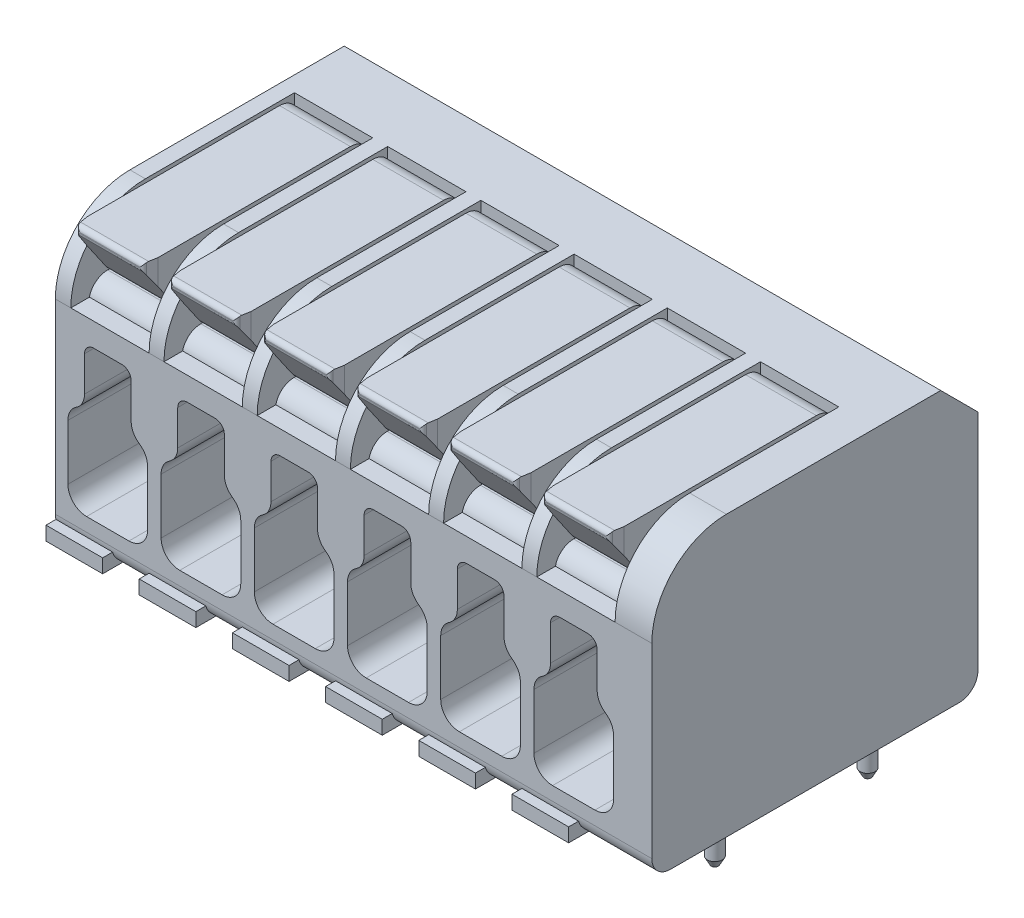
from build123d import *
from OCP.BRepFilletAPI import BRepFilletAPI_MakeChamfer

# Parameters (mm, degrees)
BOSS_EXTRUDE1_DEPTH = 32
CUT_EXTRUDE1_DEPTH  = 10
SKETCH2_3_W         = 4.2
SKETCH2_3_H         = 3.22340893
CUT_EXTRUDE2_DEPTH  = 12
SKETCH2_4_W         = 4.2
SKETCH2_4_H         = 0.77659107
CUT_EXTRUDE3_DEPTH  = 1
FILLET3_R           = 1
BOSS_EXTRUDE2_START = -18
SKETCH2_5_W         = 3.039090902
SKETCH2_5_H         = 0.743740294
BOSS_EXTRUDE2_DEPTH = 18.5
BOSS_EXTRUDE3_START = 0.2
BOSS_EXTRUDE3_DEPTH = 3.8
CUT_EXTRUDE4_DEPTH  = 5
SKETCH4_R           = 0.4
BOSS_EXTRUDE4_DEPTH = 5
CHAMFER1_SIZE       = 0.4
CHAMFER1_SIZE2      = 0.212683773
LPATTERN1_START     = 5
LPATTERN1_DEPTH     = 3.039090902
LPATTERN1_START_2   = 10
LPATTERN1_2_DEPTH   = 3.039090902
LPATTERN1_START_3   = 15
LPATTERN1_3_DEPTH   = 3.039090902
LPATTERN1_START_4   = 20
LPATTERN1_4_DEPTH   = 3.039090902
LPATTERN1_START_5   = 25
LPATTERN1_5_DEPTH   = 3.039090902
LPATTERN1_START_6   = 5.83
LPATTERN1_16_DEPTH  = 4.2
LPATTERN1_START_7   = 10.83
LPATTERN1_17_DEPTH  = 4.2
LPATTERN1_START_8   = 15.83
LPATTERN1_18_DEPTH  = 4.2
LPATTERN1_START_9   = 20.83
LPATTERN1_19_DEPTH  = 4.2
LPATTERN1_START_10  = 25.83
LPATTERN1_20_DEPTH  = 4.2
LPATTERN1_START_11  = -10
LPATTERN1_21_DEPTH  = 10
LPATTERN2_COUNT     = 6
LPATTERN2_PITCH     = 5


# Read off the part's stored shape, not the designer's step: LPattern1
with BuildPart() as part:
    # Sketch1 → Boss-Extrude1 (new body)
    with BuildSketch(Plane(origin=(0, 0, 0), x_dir=(0, 0, -1), z_dir=(1, 0, 0))):
        with BuildLine():
            Line((15.5, 15), (17.5, 13))
            Line((17.5, 13), (17.5, 1))
            ThreePointArc((17.5, 1), (17.207106781, 0.292893219), (16.5, 0))
            Line((16.5, 0), (1, 0))
            ThreePointArc((1, 0), (0.292893219, 0.292893219), (0, 1))
            Line((0, 1), (0, 11))
            ThreePointArc((0, 11), (1.171572875, 13.828427125), (4, 15))
            Line((4, 15), (15.5, 15))
        make_face()
    extrude(amount=BOSS_EXTRUDE1_DEPTH)

    # Sketch2 → Cut-Extrude1 (cut)
    with BuildSketch(Plane.XY):
        with BuildLine():
            Line((2.067688436, 9.742953882), (3.568332036, 9.742953882))
            ThreePointArc((3.568332036, 9.742953882), (3.921885427, 9.596507273), (4.068332036, 9.242953882))
            Line((4.068332036, 9.242953882), (4.068332036, 7.356120034))
            ThreePointArc((4.068332036, 7.356120034), (4.185188026, 6.887018065), (4.50844535, 6.527550846))
            ThreePointArc((4.50844535, 6.527550846), (4.831702674, 6.168083627), (4.948558664, 5.698981659))
            Line((4.948558664, 5.698981659), (4.948558664, 2.730887774))
            ThreePointArc((4.948558664, 2.730887774), (4.655665445, 2.023780993), (3.948558664, 1.730887774))
            Line((3.948558664, 1.730887774), (1.675767064, 1.730887774))
            ThreePointArc((1.675767064, 1.730887774), (0.968660283, 2.023780993), (0.675767064, 2.730887774))
            Line((0.675767064, 2.730887774), (0.675767064, 5.698981659))
            ThreePointArc((0.675767064, 5.698981659), (0.794279879, 6.171189603), (1.12172775, 6.531472162))
            ThreePointArc((1.12172775, 6.531472162), (1.449175621, 6.891754721), (1.567688436, 7.363962665))
            Line((1.567688436, 7.363962665), (1.567688436, 9.242953882))
            ThreePointArc((1.567688436, 9.242953882), (1.714135045, 9.596507273), (2.067688436, 9.742953882))
        make_face()
    extrude(amount=-CUT_EXTRUDE1_DEPTH, mode=Mode.SUBTRACT)

    # Sketch2<3> → Cut-Extrude2 (cut)
    with BuildSketch(Plane.XY):
        with Locations((2.93, 13.388295535)):
            Rectangle(SKETCH2_3_W, SKETCH2_3_H)
    extrude(amount=-CUT_EXTRUDE2_DEPTH, mode=Mode.SUBTRACT)

    # Sketch2<4> → Cut-Extrude3 (cut)
    with BuildSketch(Plane.XY):
        with Locations((2.93, 11.388295535)):
            Rectangle(SKETCH2_4_W, SKETCH2_4_H)
    extrude(amount=-CUT_EXTRUDE3_DEPTH, mode=Mode.SUBTRACT)

    # Fillet3
    # the kernel refuses this fillet: 1 mm, written as the material it takes off along each edge
    with BuildSketch(Plane(origin=(5.03, 11.77659107, -1), x_dir=(0, 0, -1), z_dir=(-1, 0, 0))) as fillet3_piece_1:
        with BuildLine():
            CenterArc((0.974724807, 1), FILLET3_R, 192.909335159, 77.090664841)
            Line((0, 0.77659107), (0, 0))
            Line((0, 0), (0.974724807, 0))
        make_face()
    extrude(amount=4.2, mode=Mode.SUBTRACT)

    # Sketch2<5> → Boss-Extrude2 (add)
    with BuildSketch(Plane.XY.offset(BOSS_EXTRUDE2_START)):
        with Locations((1.519545451, 0.371870147)):
            Rectangle(SKETCH2_5_W, SKETCH2_5_H)
    extrude(amount=BOSS_EXTRUDE2_DEPTH)

    # Sketch4 → Boss-Extrude4 (add)
    with BuildSketch(Plane.XZ):
        with Locations(Location((2.95, -7.43, 0), (0, 0, 90))):
            Circle(SKETCH4_R)
        with Locations(Location((2.95, -15.63, 0), (0, 0, 90))):
            Circle(SKETCH4_R)
    extrude(amount=BOSS_EXTRUDE4_DEPTH)

    # Chamfer1: one chamfer whose edges measure the first distance from different faces: ONE call of the kernel's chamfer builder (chamfer() names one face for all edges)
    chamfer1_edges_1 = [part.edges().sort_by_distance(p)[0] for p in [
        (2.95, -5, -7.83),
    ]]
    chamfer1_side_1 = [part.faces().sort_by_distance(p)[0] for p in [
        (2.95, -2.5, -7.83),
    ]]
    chamfer1_edges_2 = [part.edges().sort_by_distance(p)[0] for p in [
        (2.95, -5, -16.03),
    ]]
    chamfer1_side_2 = [part.faces().sort_by_distance(p)[0] for p in [
        (2.95, -2.5, -16.03),
    ]]
    chamfer1 = BRepFilletAPI_MakeChamfer(part.part.solid().wrapped)
    for e in chamfer1_edges_1:
        chamfer1.Add(CHAMFER1_SIZE, CHAMFER1_SIZE2, e.wrapped, chamfer1_side_1[0].wrapped)  # the first distance lies on this face
    for e in chamfer1_edges_2:
        chamfer1.Add(CHAMFER1_SIZE, CHAMFER1_SIZE2, e.wrapped, chamfer1_side_2[0].wrapped)  # the first distance lies on this face
    add(Compound.cast(chamfer1.Shape()), mode=Mode.REPLACE)

    # LPattern1 outline → LPattern1 (add)
    with BuildSketch(Plane.YZ.offset(LPATTERN1_START)):
        with BuildLine():
            ThreePointArc((0.743740294, -17.466607968), (0.207453564, -17.109811567), (0, -16.5))
            Line((0, -16.5), (0, -18))
            Line((0, -18), (0.743740294, -18))
            Line((0.743740294, -18), (0.743740294, -17.466607968))
        make_face()
        with BuildLine():
            ThreePointArc((0, -1), (0.207453564, -0.390188433), (0.743740294, -0.033392032))
            Line((0.743740294, -0.033392032), (0.743740294, 0.5))
            Line((0.743740294, 0.5), (0, 0.5))
            Line((0, 0.5), (0, -1))
        make_face()
    extrude(amount=LPATTERN1_DEPTH)

    # LPattern1 2 outline → LPattern1 2 (add)
    with BuildSketch(Plane.YZ.offset(LPATTERN1_START_2)):
        with BuildLine():
            ThreePointArc((0.743740294, -17.466607968), (0.207453564, -17.109811567), (0, -16.5))
            Line((0, -16.5), (0, -18))
            Line((0, -18), (0.743740294, -18))
            Line((0.743740294, -18), (0.743740294, -17.466607968))
        make_face()
        with BuildLine():
            ThreePointArc((0, -1), (0.207453564, -0.390188433), (0.743740294, -0.033392032))
            Line((0.743740294, -0.033392032), (0.743740294, 0.5))
            Line((0.743740294, 0.5), (0, 0.5))
            Line((0, 0.5), (0, -1))
        make_face()
    extrude(amount=LPATTERN1_2_DEPTH)

    # LPattern1 3 outline → LPattern1 3 (add)
    with BuildSketch(Plane.YZ.offset(LPATTERN1_START_3)):
        with BuildLine():
            ThreePointArc((0.743740294, -17.466607968), (0.207453564, -17.109811567), (0, -16.5))
            Line((0, -16.5), (0, -18))
            Line((0, -18), (0.743740294, -18))
            Line((0.743740294, -18), (0.743740294, -17.466607968))
        make_face()
        with BuildLine():
            ThreePointArc((0, -1), (0.207453564, -0.390188433), (0.743740294, -0.033392032))
            Line((0.743740294, -0.033392032), (0.743740294, 0.5))
            Line((0.743740294, 0.5), (0, 0.5))
            Line((0, 0.5), (0, -1))
        make_face()
    extrude(amount=LPATTERN1_3_DEPTH)

    # LPattern1 4 outline → LPattern1 4 (add)
    with BuildSketch(Plane.YZ.offset(LPATTERN1_START_4)):
        with BuildLine():
            ThreePointArc((0.743740294, -17.466607968), (0.207453564, -17.109811567), (0, -16.5))
            Line((0, -16.5), (0, -18))
            Line((0, -18), (0.743740294, -18))
            Line((0.743740294, -18), (0.743740294, -17.466607968))
        make_face()
        with BuildLine():
            ThreePointArc((0, -1), (0.207453564, -0.390188433), (0.743740294, -0.033392032))
            Line((0.743740294, -0.033392032), (0.743740294, 0.5))
            Line((0.743740294, 0.5), (0, 0.5))
            Line((0, 0.5), (0, -1))
        make_face()
    extrude(amount=LPATTERN1_4_DEPTH)

    # LPattern1 5 outline → LPattern1 5 (add)
    with BuildSketch(Plane.YZ.offset(LPATTERN1_START_5)):
        with BuildLine():
            ThreePointArc((0.743740294, -17.466607968), (0.207453564, -17.109811567), (0, -16.5))
            Line((0, -16.5), (0, -18))
            Line((0, -18), (0.743740294, -18))
            Line((0.743740294, -18), (0.743740294, -17.466607968))
        make_face()
        with BuildLine():
            ThreePointArc((0, -1), (0.207453564, -0.390188433), (0.743740294, -0.033392032))
            Line((0.743740294, -0.033392032), (0.743740294, 0.5))
            Line((0.743740294, 0.5), (0, 0.5))
            Line((0, 0.5), (0, -1))
        make_face()
    extrude(amount=LPATTERN1_5_DEPTH)

    # LPattern1 6 outline → LPattern1 6 (revolve)
    with BuildSketch(Plane(origin=(7.95, 0, -7.43), x_dir=(1, 0, 0), z_dir=(0, 0, 1))):
        Polygon((0, 0), (0, -5), (0.187316227, -5), (0.4, -4.6), (0.4, 0), align=None)
    revolve(axis=Axis((7.95, 0, -7.43), (0, 1, 0)))

    # LPattern1 7 outline → LPattern1 7 (revolve)
    with BuildSketch(Plane(origin=(27.95, 0, -15.63), x_dir=(1, 0, 0), z_dir=(0, 0, 1))):
        Polygon((0, 0), (0, -5), (0.187316227, -5), (0.4, -4.6), (0.4, 0), align=None)
    revolve(axis=Axis((27.95, 0, -15.63), (0, 1, 0)))

    # LPattern1 8 outline → LPattern1 8 (revolve)
    with BuildSketch(Plane(origin=(17.95, 0, -7.43), x_dir=(1, 0, 0), z_dir=(0, 0, 1))):
        Polygon((0, 0), (0, -5), (0.187316227, -5), (0.4, -4.6), (0.4, 0), align=None)
    revolve(axis=Axis((17.95, 0, -7.43), (0, 1, 0)))

    # LPattern1 9 outline → LPattern1 9 (revolve)
    with BuildSketch(Plane(origin=(12.95, 0, -15.63), x_dir=(1, 0, 0), z_dir=(0, 0, 1))):
        Polygon((0, 0), (0, -5), (0.187316227, -5), (0.4, -4.6), (0.4, 0), align=None)
    revolve(axis=Axis((12.95, 0, -15.63), (0, 1, 0)))

    # LPattern1 10 outline → LPattern1 10 (revolve)
    with BuildSketch(Plane(origin=(12.95, 0, -7.43), x_dir=(1, 0, 0), z_dir=(0, 0, 1))):
        Polygon((0, 0), (0, -5), (0.187316227, -5), (0.4, -4.6), (0.4, 0), align=None)
    revolve(axis=Axis((12.95, 0, -7.43), (0, 1, 0)))

    # LPattern1 11 outline → LPattern1 11 (revolve)
    with BuildSketch(Plane(origin=(7.95, 0, -15.63), x_dir=(1, 0, 0), z_dir=(0, 0, 1))):
        Polygon((0, 0), (0, -5), (0.187316227, -5), (0.4, -4.6), (0.4, 0), align=None)
    revolve(axis=Axis((7.95, 0, -15.63), (0, 1, 0)))

    # LPattern1 12 outline → LPattern1 12 (revolve)
    with BuildSketch(Plane(origin=(27.95, 0, -7.43), x_dir=(1, 0, 0), z_dir=(0, 0, 1))):
        Polygon((0, 0), (0, -5), (0.187316227, -5), (0.4, -4.6), (0.4, 0), align=None)
    revolve(axis=Axis((27.95, 0, -7.43), (0, 1, 0)))

    # LPattern1 13 outline → LPattern1 13 (revolve)
    with BuildSketch(Plane(origin=(22.95, 0, -15.63), x_dir=(1, 0, 0), z_dir=(0, 0, 1))):
        Polygon((0, 0), (0, -5), (0.187316227, -5), (0.4, -4.6), (0.4, 0), align=None)
    revolve(axis=Axis((22.95, 0, -15.63), (0, 1, 0)))

    # LPattern1 14 outline → LPattern1 14 (revolve)
    with BuildSketch(Plane(origin=(22.95, 0, -7.43), x_dir=(1, 0, 0), z_dir=(0, 0, 1))):
        Polygon((0, 0), (0, -5), (0.187316227, -5), (0.4, -4.6), (0.4, 0), align=None)
    revolve(axis=Axis((22.95, 0, -7.43), (0, 1, 0)))

    # LPattern1 15 outline → LPattern1 15 (revolve)
    with BuildSketch(Plane(origin=(17.95, 0, -15.63), x_dir=(1, 0, 0), z_dir=(0, 0, 1))):
        Polygon((0, 0), (0, -5), (0.187316227, -5), (0.4, -4.6), (0.4, 0), align=None)
    revolve(axis=Axis((17.95, 0, -15.63), (0, 1, 0)))

    # LPattern1 16 outline → LPattern1 16 (cut)
    with BuildSketch(Plane.YZ.offset(LPATTERN1_START_6)):
        with BuildLine():
            ThreePointArc((11, -1), (11.558706448, -1.351591166), (11.77659107, -1.974724807))
            Line((11.77659107, -1.974724807), (11.77659107, -12))
            Line((11.77659107, -12), (15, -12))
            Line((15, -12), (15, -4))
            ThreePointArc((15, -4), (13.828427125, -1.171572875), (11, 0))
            Line((11, 0), (11, -1))
        make_face()
    extrude(amount=LPATTERN1_16_DEPTH, mode=Mode.SUBTRACT)

    # LPattern1 17 outline → LPattern1 17 (cut)
    with BuildSketch(Plane.YZ.offset(LPATTERN1_START_7)):
        with BuildLine():
            ThreePointArc((11, -1), (11.558706448, -1.351591166), (11.77659107, -1.974724807))
            Line((11.77659107, -1.974724807), (11.77659107, -12))
            Line((11.77659107, -12), (15, -12))
            Line((15, -12), (15, -4))
            ThreePointArc((15, -4), (13.828427125, -1.171572875), (11, 0))
            Line((11, 0), (11, -1))
        make_face()
    extrude(amount=LPATTERN1_17_DEPTH, mode=Mode.SUBTRACT)

    # LPattern1 18 outline → LPattern1 18 (cut)
    with BuildSketch(Plane.YZ.offset(LPATTERN1_START_8)):
        with BuildLine():
            ThreePointArc((11, -1), (11.558706448, -1.351591166), (11.77659107, -1.974724807))
            Line((11.77659107, -1.974724807), (11.77659107, -12))
            Line((11.77659107, -12), (15, -12))
            Line((15, -12), (15, -4))
            ThreePointArc((15, -4), (13.828427125, -1.171572875), (11, 0))
            Line((11, 0), (11, -1))
        make_face()
    extrude(amount=LPATTERN1_18_DEPTH, mode=Mode.SUBTRACT)

    # LPattern1 19 outline → LPattern1 19 (cut)
    with BuildSketch(Plane.YZ.offset(LPATTERN1_START_9)):
        with BuildLine():
            ThreePointArc((11, -1), (11.558706448, -1.351591166), (11.77659107, -1.974724807))
            Line((11.77659107, -1.974724807), (11.77659107, -12))
            Line((11.77659107, -12), (15, -12))
            Line((15, -12), (15, -4))
            ThreePointArc((15, -4), (13.828427125, -1.171572875), (11, 0))
            Line((11, 0), (11, -1))
        make_face()
    extrude(amount=LPATTERN1_19_DEPTH, mode=Mode.SUBTRACT)

    # LPattern1 20 outline → LPattern1 20 (cut)
    with BuildSketch(Plane.YZ.offset(LPATTERN1_START_10)):
        with BuildLine():
            ThreePointArc((11, -1), (11.558706448, -1.351591166), (11.77659107, -1.974724807))
            Line((11.77659107, -1.974724807), (11.77659107, -12))
            Line((11.77659107, -12), (15, -12))
            Line((15, -12), (15, -4))
            ThreePointArc((15, -4), (13.828427125, -1.171572875), (11, 0))
            Line((11, 0), (11, -1))
        make_face()
    extrude(amount=LPATTERN1_20_DEPTH, mode=Mode.SUBTRACT)

    # LPattern1 21 outline → LPattern1 21 (cut)
    with BuildSketch(Plane.XY.offset(LPATTERN1_START_11)):
        with BuildLine():
            Line((28.568332036, 9.742953882), (27.067688436, 9.742953882))
            ThreePointArc((27.067688436, 9.742953882), (26.714135045, 9.596507273), (26.567688436, 9.242953882))
            Line((26.567688436, 9.242953882), (26.567688436, 7.363962665))
            ThreePointArc((26.567688436, 7.363962665), (26.449175621, 6.891754721), (26.12172775, 6.531472162))
            ThreePointArc((26.12172775, 6.531472162), (25.794279879, 6.171189603), (25.675767064, 5.698981659))
            Line((25.675767064, 5.698981659), (25.675767064, 2.730887774))
            ThreePointArc((25.675767064, 2.730887774), (25.968660283, 2.023780993), (26.675767064, 1.730887774))
            Line((26.675767064, 1.730887774), (28.948558664, 1.730887774))
            ThreePointArc((28.948558664, 1.730887774), (29.655665445, 2.023780993), (29.948558664, 2.730887774))
            Line((29.948558664, 2.730887774), (29.948558664, 5.698981659))
            ThreePointArc((29.948558664, 5.698981659), (29.831702674, 6.168083627), (29.50844535, 6.527550846))
            ThreePointArc((29.50844535, 6.527550846), (29.185188026, 6.887018065), (29.068332036, 7.356120034))
            Line((29.068332036, 7.356120034), (29.068332036, 9.242953882))
            ThreePointArc((29.068332036, 9.242953882), (28.921885427, 9.596507273), (28.568332036, 9.742953882))
        make_face()
        with BuildLine():
            Line((23.568332036, 9.742953882), (22.067688436, 9.742953882))
            ThreePointArc((22.067688436, 9.742953882), (21.714135045, 9.596507273), (21.567688436, 9.242953882))
            Line((21.567688436, 9.242953882), (21.567688436, 7.363962665))
            ThreePointArc((21.567688436, 7.363962665), (21.449175621, 6.891754721), (21.12172775, 6.531472162))
            ThreePointArc((21.12172775, 6.531472162), (20.794279879, 6.171189603), (20.675767064, 5.698981659))
            Line((20.675767064, 5.698981659), (20.675767064, 2.730887774))
            ThreePointArc((20.675767064, 2.730887774), (20.968660283, 2.023780993), (21.675767064, 1.730887774))
            Line((21.675767064, 1.730887774), (23.948558664, 1.730887774))
            ThreePointArc((23.948558664, 1.730887774), (24.655665445, 2.023780993), (24.948558664, 2.730887774))
            Line((24.948558664, 2.730887774), (24.948558664, 5.698981659))
            ThreePointArc((24.948558664, 5.698981659), (24.831702674, 6.168083627), (24.50844535, 6.527550846))
            ThreePointArc((24.50844535, 6.527550846), (24.185188026, 6.887018065), (24.068332036, 7.356120034))
            Line((24.068332036, 7.356120034), (24.068332036, 9.242953882))
            ThreePointArc((24.068332036, 9.242953882), (23.921885427, 9.596507273), (23.568332036, 9.742953882))
        make_face()
        with BuildLine():
            Line((18.568332036, 9.742953882), (17.067688436, 9.742953882))
            ThreePointArc((17.067688436, 9.742953882), (16.714135045, 9.596507273), (16.567688436, 9.242953882))
            Line((16.567688436, 9.242953882), (16.567688436, 7.363962665))
            ThreePointArc((16.567688436, 7.363962665), (16.449175621, 6.891754721), (16.12172775, 6.531472162))
            ThreePointArc((16.12172775, 6.531472162), (15.794279879, 6.171189603), (15.675767064, 5.698981659))
            Line((15.675767064, 5.698981659), (15.675767064, 2.730887774))
            ThreePointArc((15.675767064, 2.730887774), (15.968660283, 2.023780993), (16.675767064, 1.730887774))
            Line((16.675767064, 1.730887774), (18.948558664, 1.730887774))
            ThreePointArc((18.948558664, 1.730887774), (19.655665445, 2.023780993), (19.948558664, 2.730887774))
            Line((19.948558664, 2.730887774), (19.948558664, 5.698981659))
            ThreePointArc((19.948558664, 5.698981659), (19.831702674, 6.168083627), (19.50844535, 6.527550846))
            ThreePointArc((19.50844535, 6.527550846), (19.185188026, 6.887018065), (19.068332036, 7.356120034))
            Line((19.068332036, 7.356120034), (19.068332036, 9.242953882))
            ThreePointArc((19.068332036, 9.242953882), (18.921885427, 9.596507273), (18.568332036, 9.742953882))
        make_face()
        with BuildLine():
            Line((13.568332036, 9.742953882), (12.067688436, 9.742953882))
            ThreePointArc((12.067688436, 9.742953882), (11.714135045, 9.596507273), (11.567688436, 9.242953882))
            Line((11.567688436, 9.242953882), (11.567688436, 7.363962665))
            ThreePointArc((11.567688436, 7.363962665), (11.449175621, 6.891754721), (11.12172775, 6.531472162))
            ThreePointArc((11.12172775, 6.531472162), (10.794279879, 6.171189603), (10.675767064, 5.698981659))
            Line((10.675767064, 5.698981659), (10.675767064, 2.730887774))
            ThreePointArc((10.675767064, 2.730887774), (10.968660283, 2.023780993), (11.675767064, 1.730887774))
            Line((11.675767064, 1.730887774), (13.948558664, 1.730887774))
            ThreePointArc((13.948558664, 1.730887774), (14.655665445, 2.023780993), (14.948558664, 2.730887774))
            Line((14.948558664, 2.730887774), (14.948558664, 5.698981659))
            ThreePointArc((14.948558664, 5.698981659), (14.831702674, 6.168083627), (14.50844535, 6.527550846))
            ThreePointArc((14.50844535, 6.527550846), (14.185188026, 6.887018065), (14.068332036, 7.356120034))
            Line((14.068332036, 7.356120034), (14.068332036, 9.242953882))
            ThreePointArc((14.068332036, 9.242953882), (13.921885427, 9.596507273), (13.568332036, 9.742953882))
        make_face()
        with BuildLine():
            Line((8.568332036, 9.742953882), (7.067688436, 9.742953882))
            ThreePointArc((7.067688436, 9.742953882), (6.714135045, 9.596507273), (6.567688436, 9.242953882))
            Line((6.567688436, 9.242953882), (6.567688436, 7.363962665))
            ThreePointArc((6.567688436, 7.363962665), (6.449175621, 6.891754721), (6.12172775, 6.531472162))
            ThreePointArc((6.12172775, 6.531472162), (5.794279879, 6.171189603), (5.675767064, 5.698981659))
            Line((5.675767064, 5.698981659), (5.675767064, 2.730887774))
            ThreePointArc((5.675767064, 2.730887774), (5.968660283, 2.023780993), (6.675767064, 1.730887774))
            Line((6.675767064, 1.730887774), (8.948558664, 1.730887774))
            ThreePointArc((8.948558664, 1.730887774), (9.655665445, 2.023780993), (9.948558664, 2.730887774))
            Line((9.948558664, 2.730887774), (9.948558664, 5.698981659))
            ThreePointArc((9.948558664, 5.698981659), (9.831702674, 6.168083627), (9.50844535, 6.527550846))
            ThreePointArc((9.50844535, 6.527550846), (9.185188026, 6.887018065), (9.068332036, 7.356120034))
            Line((9.068332036, 7.356120034), (9.068332036, 9.242953882))
            ThreePointArc((9.068332036, 9.242953882), (8.921885427, 9.596507273), (8.568332036, 9.742953882))
        make_face()
    extrude(amount=LPATTERN1_21_DEPTH, mode=Mode.SUBTRACT)


with BuildPart() as body_2:
    # Sketch3 → Boss-Extrude3 (new body)
    with BuildSketch(Plane.ZY.offset(-5.03).offset(BOSS_EXTRUDE3_START)):
        with BuildLine():
            Line((-12, 14), (-12, 11.77659107))
            Line((-12, 11.77659107), (-2.498455168, 11.77659107))
            ThreePointArc((-2.498455168, 11.77659107), (-2.034503203, 11.890730712), (-1.67646186, 12.207093921))
            Line((-1.67646186, 12.207093921), (-0.044501673, 14.562611162))
            ThreePointArc((-0.044501673, 14.562611162), (-0.011384638, 14.630401878), (0, 14.704985449))
            Line((0, 14.704985449), (0, 14.75))
            ThreePointArc((0, 14.75), (-0.073223305, 14.926776695), (-0.25, 15))
            Line((-0.25, 15), (-11, 15))
            ThreePointArc((-11, 15), (-11.707106781, 14.707106781), (-12, 14))
        make_face()
    extrude(amount=BOSS_EXTRUDE3_DEPTH)

    # Sketch5 → Cut-Extrude4 (cut)
    with BuildSketch(Plane(origin=(0, 15, 0), x_dir=(1, 0, 0), z_dir=(0, 1, 0))):
        with BuildLine():
            Line((4.83, 0.680553818), (4.83, 0))
            Line((4.83, 0), (4.542180074, 0))
            ThreePointArc((4.542180074, 0), (4.670737596, 0.046791111), (4.739141624, 0.165270364))
            Line((4.739141624, 0.165270364), (4.83, 0.680553818))
        make_face()
        with BuildLine():
            Line((1.03, 0.680553818), (1.120858376, 0.165270364))
            ThreePointArc((1.120858376, 0.165270364), (1.189262404, 0.046791111), (1.317819926, 0))
            Line((1.317819926, 0), (1.03, 0))
            Line((1.03, 0), (1.03, 0.680553818))
        make_face()
    extrude(amount=-CUT_EXTRUDE4_DEPTH, mode=Mode.SUBTRACT)


with BuildPart() as lpattern2_1:
    # LPattern2: pattern copy
    add(body_2.part.moved(Location(Vector(1, 0, 0) * (1 * LPATTERN2_PITCH))))


with BuildPart() as lpattern2_2:
    # LPattern2: pattern copy
    add(body_2.part.moved(Location(Vector(1, 0, 0) * (2 * LPATTERN2_PITCH))))


with BuildPart() as lpattern2_3:
    # LPattern2: pattern copy
    add(body_2.part.moved(Location(Vector(1, 0, 0) * (3 * LPATTERN2_PITCH))))


with BuildPart() as lpattern2_4:
    # LPattern2: pattern copy
    add(body_2.part.moved(Location(Vector(1, 0, 0) * (4 * LPATTERN2_PITCH))))


with BuildPart() as lpattern2_5:
    # LPattern2: pattern copy
    add(body_2.part.moved(Location(Vector(1, 0, 0) * (5 * LPATTERN2_PITCH))))


solid = Compound([part.part, body_2.part, lpattern2_1.part, lpattern2_2.part, lpattern2_3.part, lpattern2_4.part, lpattern2_5.part])
